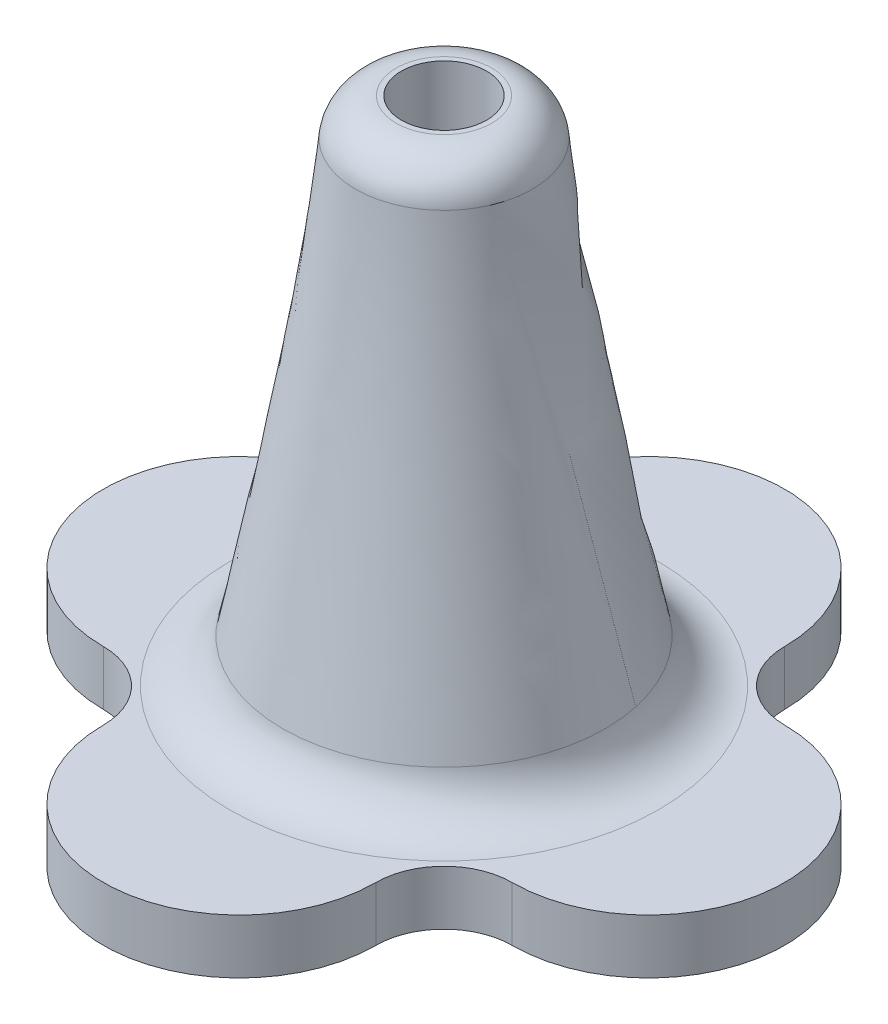
from build123d import *

# Parameters (mm, degrees)
BOSS_EXTRUDE1_DEPTH = 2.032
FILLET1_R           = 2.54
SKETCH4_R           = 1.5875
CUT_EXTRUDE1_DEPTH  = 19.05
FILLET6_R           = 2.032
FILLET7_R           = 1.524


with BuildPart() as part:
    # Sketch1 → Boss-Extrude1 (new body)
    with BuildSketch(Plane(origin=(0, 0, 0), x_dir=(1, 0, 0), z_dir=(0, 1, 0))):
        with BuildLine():
            Line((-5.08, -7.62), (-5.08, -5.08))
            Line((-5.08, -5.08), (-7.62, -5.08))
            ThreePointArc((-7.62, -5.08), (-12.7, 0), (-7.62, 5.08))
            Line((-7.62, 5.08), (-5.08, 5.08))
            Line((-5.08, 5.08), (-5.08, 7.62))
            ThreePointArc((-5.08, 7.62), (0, 12.7), (5.08, 7.62))
            Line((5.08, 7.62), (5.08, 5.08))
            Line((5.08, 5.08), (7.62, 5.08))
            ThreePointArc((7.62, 5.08), (12.7, 0), (7.62, -5.08))
            Line((7.62, -5.08), (5.08, -5.08))
            Line((5.08, -5.08), (5.08, -7.62))
            ThreePointArc((5.08, -7.62), (0, -12.7), (-5.08, -7.62))
        make_face()
    extrude(amount=BOSS_EXTRUDE1_DEPTH)

    # Fillet1
    fillet1_edges = [part.edges().sort_by_distance(p)[0] for p in [
        (-5.08, 1.016, -5.08),
        (-5.08, 1.016, 5.08),
        (5.08, 1.016, 5.08),
        (5.08, 1.016, -5.08),
    ]]
    fillet(fillet1_edges, radius=FILLET1_R - 0.0001)  # a hair under: the kernel refuses the full size

    # Loft1: read off the stored shape, not the designer's step
    # Loft1: loft between two sections, ruled curve by curve
    loft1_from = [
        Edge.make_bspline([(6.165113119, 2.032, -1.52114438), (3.12282436, 2.032, -13.851370619), (-9.207401879, 2.032, -10.809081859), (-6.165113119, 2.032, 1.52114438), (-3.12282436, 2.032, 13.851370619), (9.207401879, 2.032, 10.809081859), (6.165113119, 2.032, -1.52114438)], [0, 0, 0, 0, 0.5, 0.5, 0.5, 1, 1, 1, 1], 3, [1, 0.333333333, 0.333333333, 1, 0.333333333, 0.333333333, 1]),
    ]
    loft1_to = [
        Edge.make_bspline([(2.787065251, 21.082, 1.520819611), (5.828704472, 21.082, -4.05331089), (0.254573971, 21.082, -7.094950112), (-2.787065251, 21.082, -1.520819611), (-5.828704472, 21.082, 4.05331089), (-0.254573971, 21.082, 7.094950112), (2.787065251, 21.082, 1.520819611)], [0, 0, 0, 0, 0.5, 0.5, 0.5, 1, 1, 1, 1], 3, [1, 0.333333333, 0.333333333, 1, 0.333333333, 0.333333333, 1]),
    ]
    loft1 = Solid(Shell([*[Face.make_surface_from_curves(loft1_from[k], loft1_to[k]) for k in range(1)], Face(Wire(loft1_from)), Face(Wire(loft1_to))]))
    add(loft1)

    # Sketch4 → Cut-Extrude1 (cut)
    with BuildSketch(Plane(origin=(0, 21.082, 0), x_dir=(1, 0, 0), z_dir=(0, 1, 0))):
        with Locations(Location((0, 0, 0), (0, 0, 270))):
            Circle(SKETCH4_R)
    extrude(amount=-CUT_EXTRUDE1_DEPTH, mode=Mode.SUBTRACT)

    # Fillet6
    fillet6_edges = [part.edges().sort_by_distance(p)[0] for p in [
        (-6.165113119, 2.032, 1.52114438),
    ]]
    fillet(fillet6_edges, radius=FILLET6_R)

    # Fillet7
    fillet7_edges = [part.edges().sort_by_distance(p)[0] for p in [
        (-2.787065251, 21.082, -1.520819611),
    ]]
    fillet(fillet7_edges, radius=FILLET7_R)


solid = part.part
